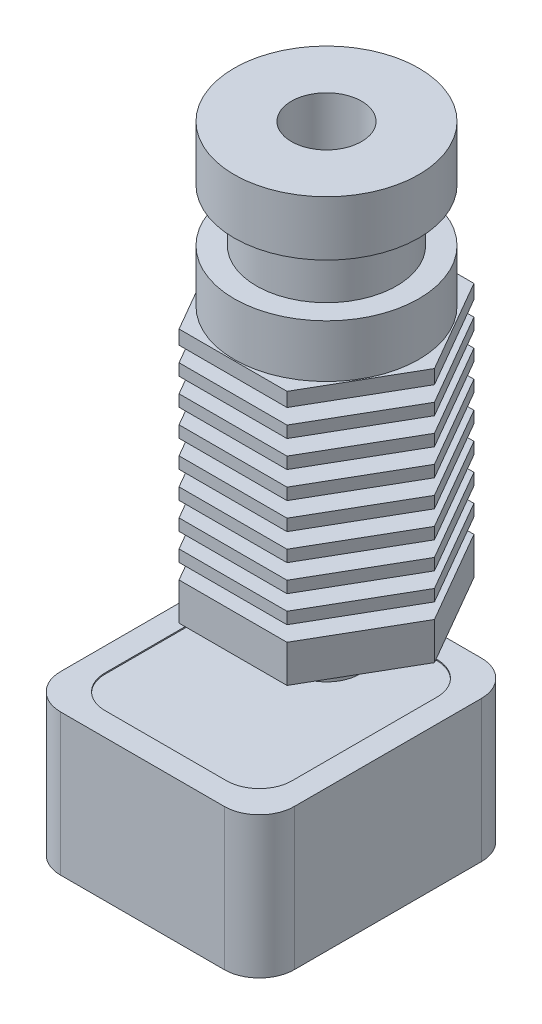
from build123d import *

# Parameters (mm, degrees)
BOSS_EXTRU_1_DEPTH         = 21.8
ESQUISSE3_R                = 9.237604307
ESQUISSE3_R_2              = 4
ENL_V_MAT_EXTRU_1_DEPTH    = 1.3
R_P_TITION_LIN_AIRE1_COUNT = 8
R_P_TITION_LIN_AIRE1_PITCH = 2.3
ESQUISSE6_W                = 16
ESQUISSE6_H                = 18
BOSS_EXTRU_2_DEPTH         = 10
ESQUISSE9_W                = 8.8
ESQUISSE9_H                = 0.9
ENL_V_MAT_EXTRU_2_DEPTH    = 5.5
ESQUISSE10_R               = 3
ENL_V_MAT_EXTRU_3_DEPTH    = 42.790519287
CONG_1_R                   = 2.8
BOSS_EXTRU_3_DEPTH         = 2
BOSS_EXTRU_3_DEPTH_BACK    = 10.1
ESQUISSE13_W               = 20
ESQUISSE13_H               = 22
CONG_2_R                   = 3
BOSS_EXTRU_4_DEPTH         = 2
ESQUISSE15_R               = 3
ENL_V_MAT_EXTRU_4_DEPTH    = 7


with BuildPart() as part:
    # Esquisse1 → Révolution1 (revolve)
    with BuildSketch(Plane.XY):
        Polygon((0, 35.5), (-7.9, 35.5), (-7.9, 30.8), (-6, 30.8), (-6, 26.3), (-7.9, 26.3), (-7.9, 21.8), (-4, 21.8), (-4, 0), (0, 0), align=None)
    revolve(axis=Axis((0, 35.5, 0), (0, -1, 0)))

    # Esquisse2 → Boss.-Extru.1 (add)
    with BuildSketch(Plane.XZ):
        Polygon((-4.618802154, -8), (4.618802154, -8), (9.237604307, 0), (4.618802154, 8), (-4.618802154, 8), (-9.237604307, 0), align=None)
    extrude(amount=-BOSS_EXTRU_1_DEPTH)

    # Esquisse3 → Enlèv. mat.-Extru.1 (cut)
    with BuildSketch(Plane(origin=(0, 3.2, 0), x_dir=(-1, 0, 0), z_dir=(0, -1, 0))):
        Circle(ESQUISSE3_R)
        with Locations(Location((0, 0, 0), (0, 0, 180))):
            Circle(ESQUISSE3_R_2, mode=Mode.SUBTRACT)
    enl_v_mat_extru_1 = extrude(amount=-ENL_V_MAT_EXTRU_1_DEPTH, mode=Mode.SUBTRACT)

    # Répétition linéaire1: Enlèv. mat.-Extru.1 ×8
    with Locations(*[(0, i * R_P_TITION_LIN_AIRE1_PITCH, 0) for i in range(1, R_P_TITION_LIN_AIRE1_COUNT)]):
        add(enl_v_mat_extru_1, mode=Mode.SUBTRACT)

    # Esquisse5 → Révolution2 (revolve)
    with BuildSketch(Plane(origin=(0, 0, 0), x_dir=(0, 0, -1), z_dir=(1, 0, 0))):
        Polygon((-1.25, 0), (-1.25, -2), (-2.9, -2), (-2.9, -4), (0, -4), (0, 0), align=None)
    revolve(axis=Axis((0, 0, 0), (0, -1, 0)))

    # Esquisse6 → Boss.-Extru.2 (add)
    with BuildSketch(Plane.XZ.offset(4)):
        with Locations((0, 4.75)):
            Rectangle(ESQUISSE6_W, ESQUISSE6_H)
    extrude(amount=BOSS_EXTRU_2_DEPTH)

    # Esquisse8 → Révolution3 (revolve)
    with BuildSketch(Plane(origin=(0, 0, 0), x_dir=(0, 0, -1), z_dir=(1, 0, 0))):
        Polygon((0, -19.5), (-0.5, -19.5), (-4.4, -17), (-4.4, -14), (0, -14), align=None)
    revolve(axis=Axis((0, -14, 0), (0, -1, 0)))

    # Esquisse9 → Enlèv. mat.-Extru.2 (cut)
    with BuildSketch(Plane.XZ.offset(19.5)):
        with Locations((0, -3.95)):
            Rectangle(ESQUISSE9_W, ESQUISSE9_H)
        with Locations((0, 3.95)):
            Rectangle(ESQUISSE9_W, ESQUISSE9_H)
    extrude(amount=-ENL_V_MAT_EXTRU_2_DEPTH, mode=Mode.SUBTRACT)

    # Esquisse10 → Enlèv. mat.-Extru.3 (cut, through all)
    with BuildSketch(Plane.ZY.offset(8)):
        with Locations((7.95, -9)):
            Circle(ESQUISSE10_R)
    extrude(amount=-ENL_V_MAT_EXTRU_3_DEPTH, mode=Mode.SUBTRACT)

    # Congé1
    cong_1_edges = [part.edges().sort_by_distance(p)[0] for p in [
        (-8, -9, 13.75),
        (-8, -9, -4.25),
        (8, -9, -4.25),
        (8, -9, 13.75),
    ]]
    fillet(cong_1_edges, radius=CONG_1_R - 0.0001)  # a hair under: the kernel refuses the full size

    # Esquisse12 → Enlèvement de matière-Révolution1 (revolve, cut)
    with BuildSketch(Plane(origin=(0, 0, 0), x_dir=(0, 0, -1), z_dir=(1, 0, 0))):
        Polygon((0, 35.5), (-0.9, 35.5), (-0.9, -14), (-0.15, -14), (-0.15, -19.5), (0, -19.5), align=None)
    revolve(axis=Axis((0, 35.5, 0), (0, -1, 0)), mode=Mode.SUBTRACT)

    # Esquisse13 → Boss.-Extru.3 (add, two sides: drawn at the far end of the back side and taken through both)
    with BuildSketch(Plane.XZ.offset(14).offset(-BOSS_EXTRU_3_DEPTH_BACK)):
        with Locations((0, 4.75)):
            Rectangle(ESQUISSE13_W, ESQUISSE13_H)
        with BuildLine():
            Line((-5.2, 13.75), (5.2, 13.75))
            ThreePointArc((5.2, 13.75), (7.179898987, 12.929898987), (8, 10.95))
            Line((8, 10.95), (8, -1.45))
            ThreePointArc((8, -1.45), (7.179898987, -3.429898987), (5.2, -4.25))
            Line((5.2, -4.25), (-5.2, -4.25))
            ThreePointArc((-5.2, -4.25), (-7.179898987, -3.429898987), (-8, -1.45))
            Line((-8, -1.45), (-8, 10.95))
            ThreePointArc((-8, 10.95), (-7.179898987, 12.929898987), (-5.2, 13.75))
        make_face(mode=Mode.SUBTRACT)
    extrude(amount=BOSS_EXTRU_3_DEPTH + BOSS_EXTRU_3_DEPTH_BACK)

    # Congé2
    cong_2_edges = [part.edges().sort_by_distance(p)[0] for p in [
        (-10, -9.95, -6.25),
        (-10, -9.95, 15.75),
        (10, -9.95, 15.75),
        (10, -9.95, -6.25),
    ]]
    fillet(cong_2_edges, radius=CONG_2_R)

    # Esquisse14 → Boss.-Extru.4 (add)
    with BuildSketch(Plane.XZ.offset(14)):
        with BuildLine():
            Line((0, 5.3), (0, 13.75))
            Line((0, 13.75), (-5.2, 13.75))
            ThreePointArc((-5.2, 13.75), (-7.179898987, 12.929898987), (-8, 10.95))
            Line((-8, 10.95), (-8, -1.45))
            ThreePointArc((-8, -1.45), (-7.179898987, -3.429898987), (-5.2, -4.25))
            Line((-5.2, -4.25), (-3.166622807, -4.25))
            ThreePointArc((-3.166622807, -4.25), (-5.030656021, 1.668082732), (0, 5.3))
        make_face()
        with BuildLine():
            Line((5.2, 13.75), (0, 13.75))
            Line((0, 13.75), (0, 5.3))
            ThreePointArc((0, 5.3), (5.030656021, 1.668082732), (3.166622807, -4.25))
            Line((3.166622807, -4.25), (5.2, -4.25))
            ThreePointArc((5.2, -4.25), (7.179898987, -3.429898987), (8, -1.45))
            Line((8, -1.45), (8, 10.95))
            ThreePointArc((8, 10.95), (7.179898987, 12.929898987), (5.2, 13.75))
        make_face()
    extrude(amount=BOSS_EXTRU_4_DEPTH)

    # Esquisse15 → Enlèv. mat.-Extru.4 (cut)
    with BuildSketch(Plane(origin=(0, 35.5, 0), x_dir=(1, 0, 0), z_dir=(0, 1, 0))):
        with Locations(Location((0, 0, 0), (0, 0, 180))):
            Circle(ESQUISSE15_R)
    extrude(amount=-ENL_V_MAT_EXTRU_4_DEPTH, mode=Mode.SUBTRACT)


solid = part.part
